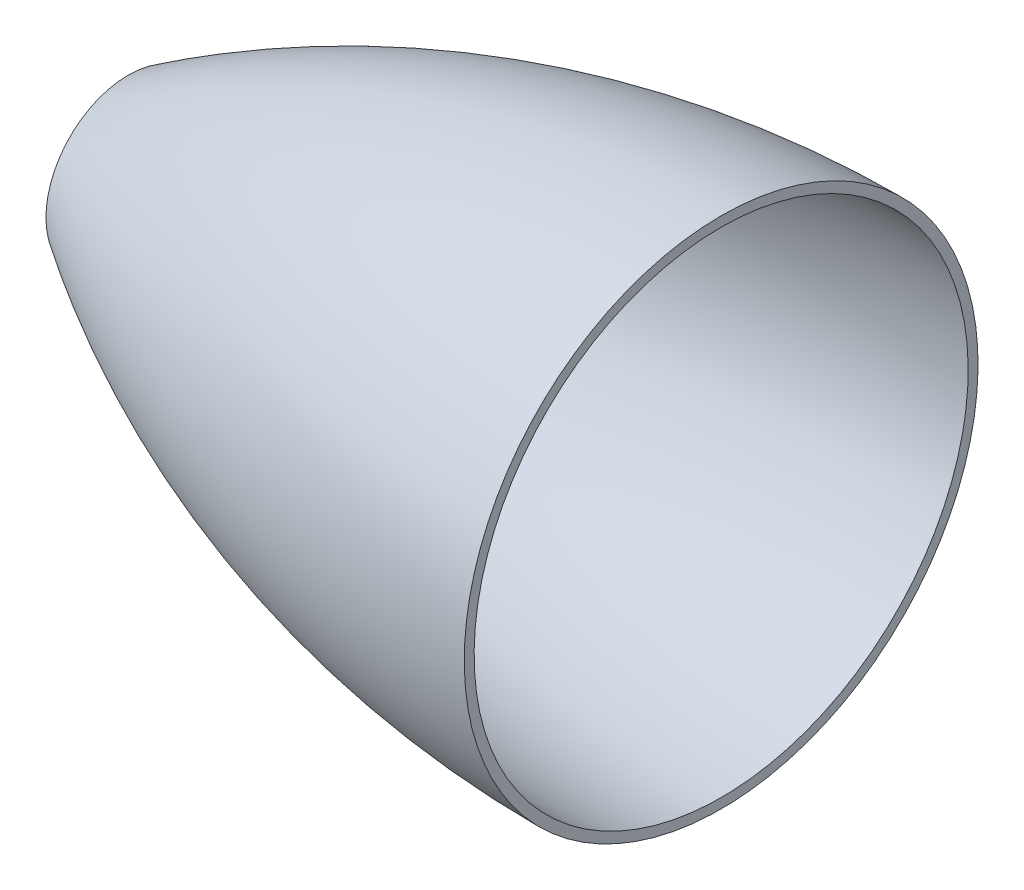
from build123d import *


with BuildPart() as part:
    # Sketch1 → Revolve1 (revolve)
    with BuildSketch(Plane.XY):
        with BuildLine():
            Line((-1040.682976555, 0), (-1040.682976555, 25))
            ThreePointArc((-1040.682976555, 25), (-954.503283525, 64.474627446), (-860.682976555, 78))
            Line((-860.682976555, 78), (-860.682976555, 75))
            ThreePointArc((-860.682976555, 75), (-952.872578306, 61.826380832), (-1037.682976555, 23.359989503))
            Line((-1037.682976555, 23.359989503), (-1037.682976555, 0))
            Line((-1037.682976555, 0), (-1040.682976555, 0))
        make_face()
    revolve(axis=Axis((-860.682976555, 0, 0), (-1, 0, 0)))


solid = part.part
